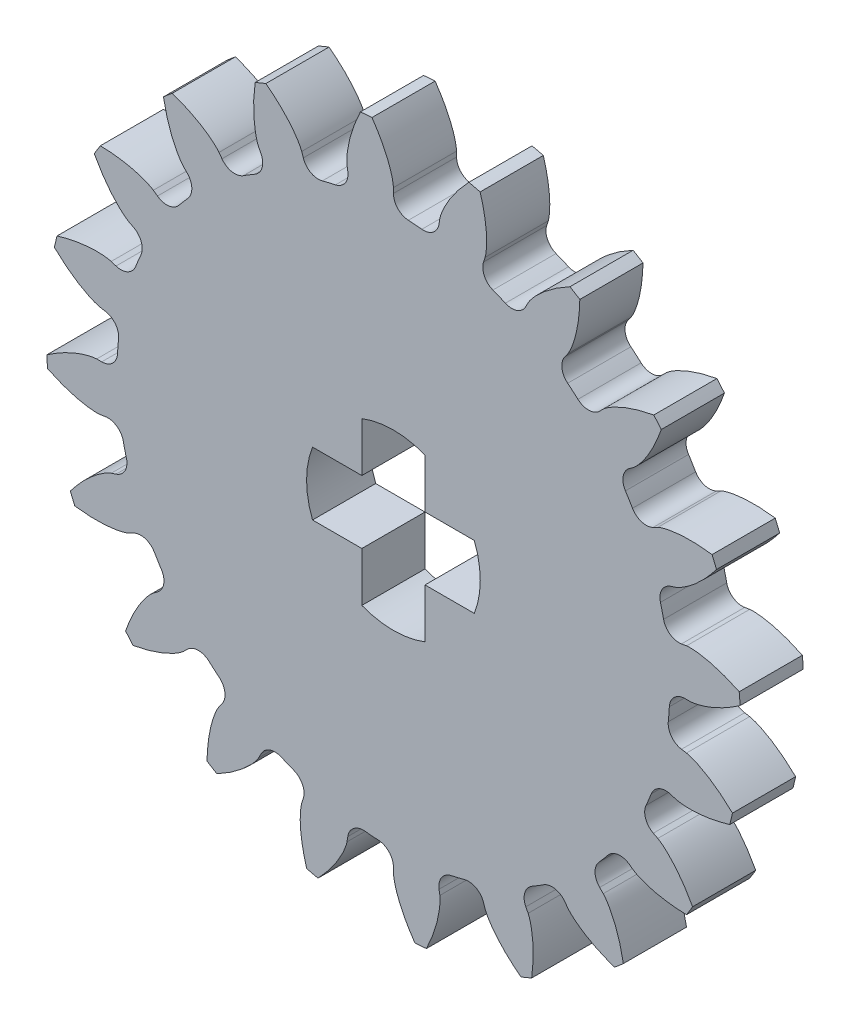
from build123d import *

# Parameters (mm, degrees)
BOSS_EXTRU_1_DEPTH           = 2
R_P_TITION_CIRCULAIRE1_COUNT = 20
ENL_V_MAT_EXTRU_1_DEPTH      = 28.358477697


with BuildPart() as part:
    # Esquisse1 → Boss.-Extru.1 (new body)
    with BuildSketch(Plane.XY):
        with BuildLine():
            Line((23.281234453, 1.470003124), (23.122760247, 1.444903276))
            ThreePointArc((23.122760247, 1.444903276), (22.761694485, 1.526440874), (22.555648797, 1.833950287))
            ThreePointArc((22.555648797, 1.833950287), (5.27697333, -0.686517088), (22.737207595, -0.472972973))
            ThreePointArc((22.737207595, -0.472972973), (22.892611448, -0.137016864), (23.236476601, 0))
            Line((23.236476601, 0), (23.396926208, 0))
            add(Edge.make_bspline(
                [(23.396926208, 0), (23.399861391, 4.0364e-05), (23.408092104, 0.000278582), (23.423643325, 0.001222565), (23.448990799, 0.003463536), (23.481234394, 0.007347943), (23.522826718, 0.013548658), (23.571695374, 0.022368665), (23.62524029, 0.033646184), (23.683294193, 0.047621516), (23.74101252, 0.063069055), (23.798384098, 0.079875717), (23.855336923, 0.097875453), (23.924069027, 0.121160019), (24.006115548, 0.151136674), (24.101419496, 0.189155078), (24.208761919, 0.235779773), (24.317285706, 0.287021084), (24.42332733, 0.340494125), (24.529536007, 0.398000739), (24.631632735, 0.456105407), (24.736635977, 0.519983998), (24.831974337, 0.580075942), (24.910760166, 0.633115412), (24.956430484, 0.664314193), (24.978964018, 0.679962574)],
                knots=[0, 0, 0, 0, 0, 0.005376749, 0.015083688, 0.02853182, 0.04661014, 0.064854849, 0.092110526, 0.119476176, 0.146842496, 0.174208854, 0.201574956, 0.228941013, 0.256307345, 0.307035032, 0.361767352, 0.416499661, 0.471231937, 0.525964282, 0.580696616, 0.635428982, 0.690161387, 0.744893688, 0.797218479, 0.797218479, 0.797218479, 0.797218479, 0.797218479], degree=4))
            ThreePointArc((24.978964018, 0.679962574), (24.966090671, 0.863050053), (24.950164333, 1.045897256))
            add(Edge.make_bspline(
                [(23.281234453, 1.470003124), (23.284139813, 1.470422421), (23.292306458, 1.471474703), (23.307813889, 1.472975089), (23.333199859, 1.474726927), (23.365654137, 1.475934353), (23.407704396, 1.476316452), (23.457351151, 1.475249776), (23.512001032, 1.472487372), (23.571526419, 1.467765731), (23.630950665, 1.461537512), (23.690245046, 1.45391266), (23.749312466, 1.445043916), (23.820840872, 1.432798091), (23.906566646, 1.416025402), (24.006644633, 1.39338389), (24.119959202, 1.364125277), (24.235162788, 1.330491692), (24.34826389, 1.294265557), (24.462160979, 1.254081643), (24.572090299, 1.212663786), (24.68579359, 1.165997774), (24.789358628, 1.121559866), (24.875471674, 1.081498219), (24.925460279, 1.057827959), (24.950164333, 1.045897256)],
                knots=[0, 0, 0, 0, 0, 0.005376749, 0.015083688, 0.02853182, 0.04661014, 0.064854849, 0.092110526, 0.119476176, 0.146842496, 0.174208854, 0.201574956, 0.228941013, 0.256307345, 0.307035032, 0.361767352, 0.416499661, 0.471231937, 0.525964282, 0.580696616, 0.635428982, 0.690161387, 0.744893688, 0.797218479, 0.797218479, 0.797218479, 0.797218479, 0.797218479], degree=4))
        make_face()
    boss_extru_1 = extrude(amount=BOSS_EXTRU_1_DEPTH)

    # Répétition circulaire1: Boss.-Extru.1 ×20 about axis
    r_p_tition_circulaire1_axis = Axis((14, 0, 2), (0, 0, 1))
    for i in range(1, R_P_TITION_CIRCULAIRE1_COUNT):
        add(boss_extru_1.rotate(r_p_tition_circulaire1_axis, i * 360 / R_P_TITION_CIRCULAIRE1_COUNT))

    # Esquisse2 → Enlèv. mat.-Extru.1 (cut, through all)
    with BuildSketch(Plane.XY.offset(2)):
        with BuildLine():
            Line((13, 1), (11.438262309, 1))
            ThreePointArc((11.438262309, 1), (11.297475379, 0.508783524), (11.25, 0))
            ThreePointArc((11.25, 0), (11.297475379, -0.508783524), (11.438262309, -1))
            Line((11.438262309, -1), (13, -1))
            Line((13, -1), (13, -2.561737691))
            ThreePointArc((13, -2.561737691), (13.491216476, -2.702524621), (14, -2.75))
            ThreePointArc((14, -2.75), (14.508783524, -2.702524621), (15, -2.561737691))
            Line((15, -2.561737691), (15, -1))
            Line((15, -1), (16.561737691, -1))
            ThreePointArc((16.561737691, -1), (16.702524621, -0.508783524), (16.75, 0))
            ThreePointArc((16.75, 0), (16.702524621, 0.508783524), (16.561737691, 1))
            Line((16.561737691, 1), (15, 1))
            Line((15, 1), (15, 2.561737691))
            ThreePointArc((15, 2.561737691), (14.508783524, 2.702524621), (14, 2.75))
            ThreePointArc((14, 2.75), (13.491216476, 2.702524621), (13, 2.561737691))
            Line((13, 2.561737691), (13, 1))
        make_face()
    extrude(amount=-ENL_V_MAT_EXTRU_1_DEPTH, mode=Mode.SUBTRACT)


solid = part.part
